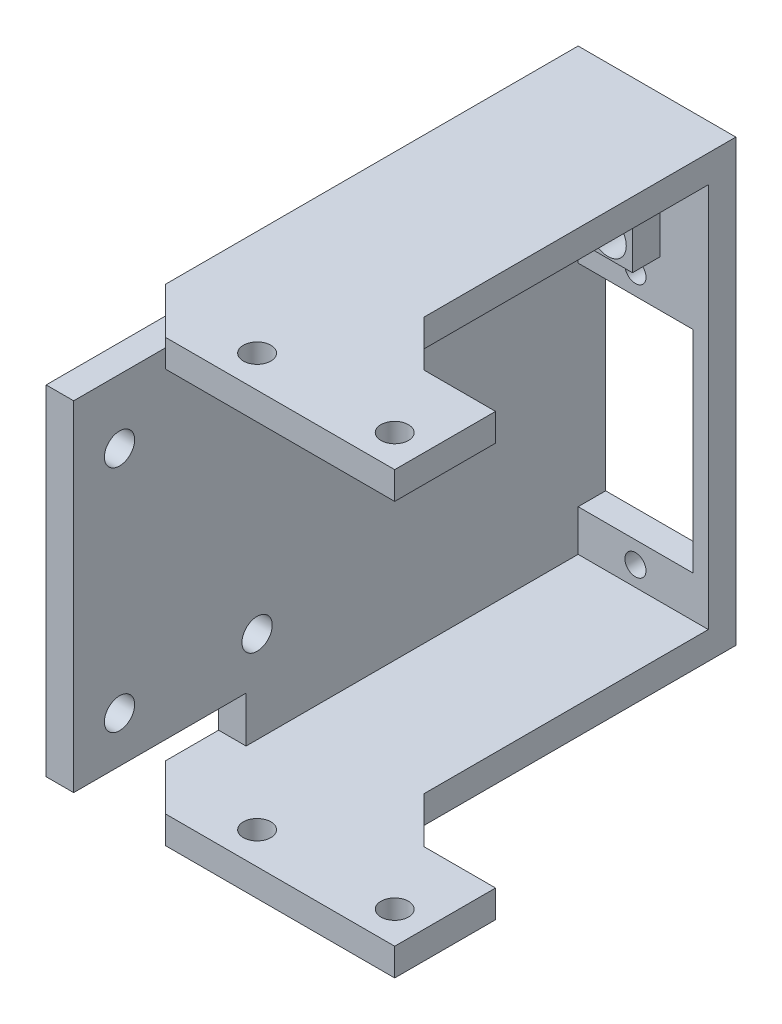
from build123d import *
from build123d.topology import SkipClean

# Parameters (mm, degrees)
SKETCH_1_W           = 30
SKETCH_1_H           = 48
EXTRUDE_1_DEPTH      = 3
SKETCH_3_W           = 30
SKETCH_3_H           = 3
EXTRUDE_2_DEPTH      = 47
CUT_EXTRUDE_2_DEPTH  = 76.524830354
CUT_EXTRUDE_3_DEPTH  = 76.524830354
SKETCH_7_W           = 3
SKETCH_7_H           = 42
EXTRUDE_3_DEPTH      = 25
SKETCH_14_W          = 3
SKETCH_14_H          = 42
EXTRUDE_6_DEPTH      = 30
SKETCH_15_R          = 1.65
CUT_EXTRUDE_6_DEPTH  = 4
SKETCH_16_R          = 1.15
SKETCH_16_W          = 12.5
SKETCH_16_H          = 23
CUT_EXTRUDE_7_DEPTH  = 10
SKETCH_17_W          = 18.8
SKETCH_17_H          = 5
CUT_EXTRUDE_8_DEPTH  = 10
SKETCH_20_R          = 1.5
CUT_EXTRUDE_11_DEPTH = 82.043198357
CUT_EXTRUDE_12_REACH = 83.043
SKETCH_22_R          = 2
SKETCH_23_W          = 5.554421841
SKETCH_23_H          = 4.674351411
SKETCH_23_R          = 2
EXTRUDE_9_DEPTH      = 3
SKETCH_30_W          = 15
SKETCH_30_H          = 39.001833612
CUT_EXTRUDE_15_DEPTH = 82.043198357
CHAMFER_1_SIZE       = 5


with BuildPart() as part:
    # 草图1 → 凸台-拉伸1 (new body)
    with BuildSketch(Plane.XY):
        with Locations((15, 24)):
            Rectangle(SKETCH_1_W, SKETCH_1_H)
    extrude(amount=EXTRUDE_1_DEPTH)

    # 草图3 → 凸台-拉伸2 (add)
    with BuildSketch(Plane.XY.offset(3)):
        with Locations((15, 46.5)):
            Rectangle(SKETCH_3_W, SKETCH_3_H)
        with Locations((15, 1.5)):
            Rectangle(SKETCH_3_W, SKETCH_3_H)
    extrude(amount=EXTRUDE_2_DEPTH)

    # 草图5 → 切除-拉伸2 (cut, through all)
    with BuildSketch(Plane.XZ):
        Polygon((0, 45), (5, 50), (0, 50), align=None)
    extrude(amount=-CUT_EXTRUDE_2_DEPTH, mode=Mode.SUBTRACT)

    # 草图6 → 切除-拉伸3 (cut, through all)
    with BuildSketch(Plane.XZ):
        Polygon((20, 0), (30, 10), (30, 0), align=None)
    extrude(amount=-CUT_EXTRUDE_3_DEPTH, mode=Mode.SUBTRACT)

    # 草图7 → 凸台-拉伸3 (add)
    with BuildSketch(Plane.XY.offset(3)):
        with Locations((1.5, 24)):
            Rectangle(SKETCH_7_W, SKETCH_7_H)
    extrude(amount=EXTRUDE_3_DEPTH)

    # 草图14 → 凸台-拉伸6 (add)
    with BuildSketch(Plane.XY.offset(28)):
        with Locations((1.5, 24)):
            Rectangle(SKETCH_14_W, SKETCH_14_H)
    extrude(amount=EXTRUDE_6_DEPTH)

    # 草图15 → 切除-拉伸6 (cut)
    with BuildSketch(Plane.ZY):
        with Locations((38, 13)):
            Circle(SKETCH_15_R)
        with Locations((38, 38)):
            Circle(SKETCH_15_R)
        with Locations((53, 38)):
            Circle(SKETCH_15_R)
        with Locations((53, 13)):
            Circle(SKETCH_15_R)
    extrude(amount=-CUT_EXTRUDE_6_DEPTH, mode=Mode.SUBTRACT)

    # 草图16 → 切除-拉伸7 (cut)
    with BuildSketch(Plane.XY.offset(3)):
        with Locations((9.25, 32.85)):
            Circle(SKETCH_16_R)
        with Locations((9.25, 5.15)):
            Circle(SKETCH_16_R)
        with Locations((9.25, 19)):
            Rectangle(SKETCH_16_W, SKETCH_16_H)
    extrude(amount=-CUT_EXTRUDE_7_DEPTH, mode=Mode.SUBTRACT)

    # 草图17 → 切除-拉伸8 (cut)
    with BuildSketch(Plane.ZY):
        with Locations((48.6, 5.5)):
            Rectangle(SKETCH_17_W, SKETCH_17_H)
    extrude(amount=-CUT_EXTRUDE_8_DEPTH, mode=Mode.SUBTRACT)

    # 草图20 → 切除-拉伸11 (cut, through all)
    with BuildSketch(Plane.XZ):
        with Locations((26.5, 46.5)):
            Circle(SKETCH_20_R)
        with Locations((11.5, 46.5)):
            Circle(SKETCH_20_R)
    extrude(amount=-CUT_EXTRUDE_11_DEPTH, mode=Mode.SUBTRACT)

    # 草图22 → 切除-拉伸12 (cut, up to next)
    with BuildSketch(Plane(origin=(0, 0, 0), x_dir=(-1, 0, 0), z_dir=(0, 0, -1)), mode=Mode.PRIVATE) as cut_extrude_12_sk1:
        with Locations((-9.25, 37.75)):
            Circle(SKETCH_22_R)
    cut_extrude_12_tool1 = extrude(cut_extrude_12_sk1.sketch, amount=-CUT_EXTRUDE_12_REACH, mode=Mode.PRIVATE) & part.part
    add(cut_extrude_12_tool1.solids().sort_by_distance((9.25, 37.75, 0))[0], mode=Mode.SUBTRACT)

    # 草图23 → 凸台-拉伸9 (add)
    with SkipClean():  # the faces are left unmerged after this step: merging them gives an invalid solid
        with BuildSketch(Plane.XY.offset(3)):
            with Locations((9.150966926, 37.89409872)):
                Rectangle(SKETCH_23_W, SKETCH_23_H)
            with Locations((9.25, 37.75)):
                Circle(SKETCH_23_R, mode=Mode.SUBTRACT)
        extrude(amount=EXTRUDE_9_DEPTH)

    # 草图30 → 切除-拉伸15 (cut, through all)
    with SkipClean():  # the faces are left unmerged after this step: merging them gives an invalid solid
        with BuildSketch(Plane(origin=(0, 48, 0), x_dir=(1, 0, 0), z_dir=(0, 1, 0))):
            with Locations((24.696716684, -19.500916806)):
                Rectangle(SKETCH_30_W, SKETCH_30_H)
        extrude(amount=-CUT_EXTRUDE_15_DEPTH, mode=Mode.SUBTRACT)

    # 倒角1
    chamfer_1_edges = [part.edges().sort_by_distance(p)[0] for p in [
        (17.196716684, 46.5, 39.001833612),
        (17.196716684, 1.5, 39.001833612),
    ]]
    chamfer(chamfer_1_edges, length=CHAMFER_1_SIZE)


solid = part.part
